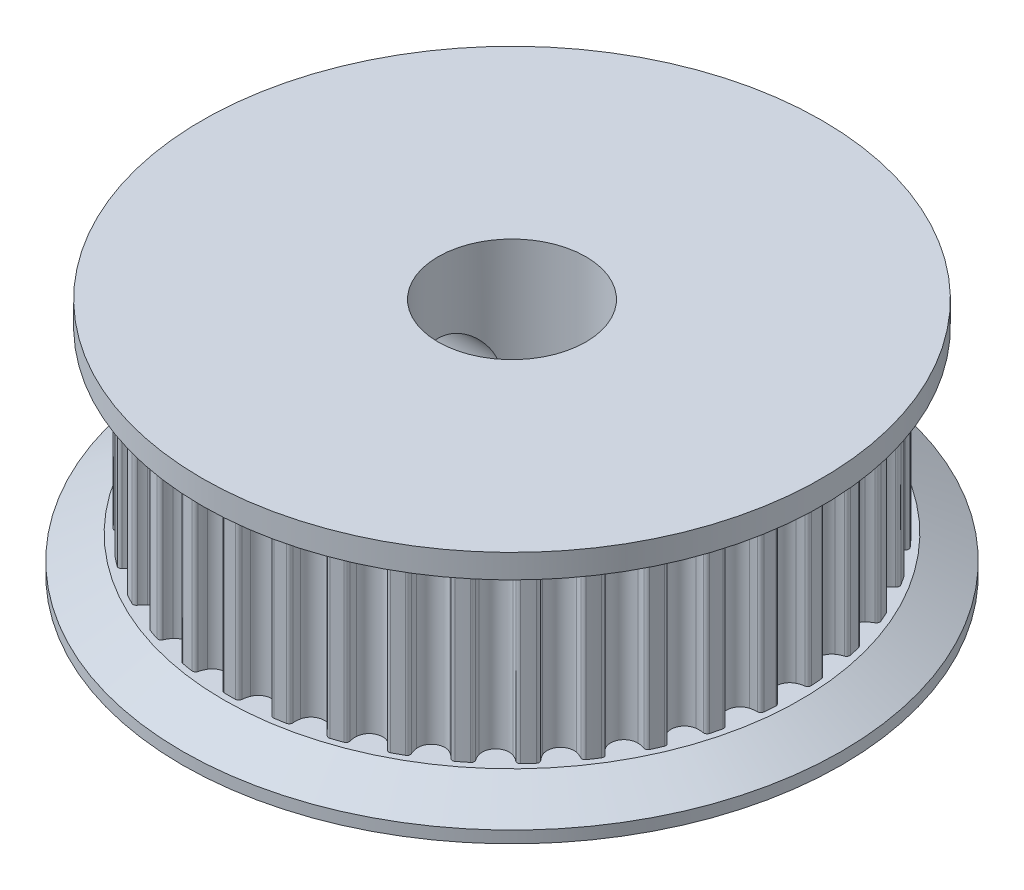
from build123d import *
from build123d.topology import SkipClean

# Parameters (mm, degrees)
SKETCH2_R           = 12.095775675
SKETCH2_R_2         = 3.1
BOSS_EXTRUDE1_DEPTH = 5
CUT_EXTRUDE3_DEPTH  = 18.821772593
CIRPATTERN3_COUNT   = 38
SKETCH4_W           = 6.5
SKETCH4_H           = 6
SKETCH5_R           = 1.6
CUT_EXTRUDE2_DEPTH  = 24.209213051
CIRPATTERN2_COUNT   = 2
CIRPATTERN2_ANGLE   = 90
SKETCH7_R           = 18
CUT_EXTRUDE4_DEPTH  = 10
SKETCH8_R           = 1.95
CUT_EXTRUDE5_DEPTH  = 21.60746395
CUT_EXTRUDE6_START  = -8
SKETCH10_R          = 2.75
CUT_EXTRUDE6_DEPTH  = 10
SKETCH11_R          = 13
BOSS_EXTRUDE3_DEPTH = 1
SKETCH12_R          = 3.1
CUT_EXTRUDE7_DEPTH  = 10


with BuildPart() as part:
    # Sketch2 → Boss-Extrude1 (new, symmetric)
    with BuildSketch(Plane(origin=(0, 0, 0), x_dir=(1, 0, 0), z_dir=(0, 1, 0))):
        Circle(SKETCH2_R)
        Circle(SKETCH2_R_2, mode=Mode.SUBTRACT)
    extrude(amount=BOSS_EXTRUDE1_DEPTH, both=True)

    # Sketch6 → Cut-Extrude3 (cut, symmetric)
    with BuildSketch(Plane(origin=(0, 0, 0), x_dir=(1, 0, 0), z_dir=(0, 1, 0))):
        with BuildLine():
            Line((0, 11.831775675), (0, 12.471775675))
            ThreePointArc((0, 12.471775675), (1.029911072, 12.429178238), (2.052786807, 12.301676911))
            Line((2.052786807, 12.301676911), (1.94744627, 11.670405676))
            ThreePointArc((1.94744627, 11.670405676), (1.832972216, 11.688931879), (1.718322087, 11.706335243))
            ThreePointArc((1.718322087, 11.706335243), (1.619459884, 11.683720455), (1.561806597, 11.600286275))
            ThreePointArc((1.561806597, 11.600286275), (1.515275101, 11.454869949), (1.447355853, 11.318129084))
            ThreePointArc((1.447355853, 11.318129084), (0.915125782, 11.043925793), (0.435287013, 11.401991499))
            ThreePointArc((0.435287013, 11.401991499), (0.390800902, 11.548046537), (0.368838776, 11.699138407))
            ThreePointArc((0.368838776, 11.699138407), (0.325704619, 11.790924073), (0.23191304, 11.829502609))
            ThreePointArc((0.23191304, 11.829502609), (0.115962089, 11.831207395), (0, 11.831775675))
        make_face()
    cut_extrude3 = extrude(amount=CUT_EXTRUDE3_DEPTH, both=True, mode=Mode.SUBTRACT)

    # CirPattern3: Cut-Extrude3 ×38 about axis
    cirpattern3_axis = Axis((0, 5, 0), (0, -1, 0))
    for i in range(1, CIRPATTERN3_COUNT):
        add(cut_extrude3.rotate(cirpattern3_axis, i * 360 / CIRPATTERN3_COUNT), mode=Mode.SUBTRACT)

    # Sketch3 → Revolve1 (revolve)
    with BuildSketch(Plane.XY):
        Polygon((-12.095775675, 5), (-13.827826483, 6), (-13.827826483, 6.5), (-3.1, 6.5), (-3.1, 5), align=None)
    revolve1 = revolve(axis=Axis((0, 0, 0), (0, 1, 0)))

    # Mirror1: Revolve1 across plane
    add(revolve1.mirror(Plane.ZX))

    # Sketch4 → Revolve2 (revolve)
    with BuildSketch(Plane.XY):
        with Locations((-6.35, 9.5)):
            Rectangle(SKETCH4_W, SKETCH4_H)
    revolve(axis=Axis((0, 0, 0), (0, 1, 0)))

    # Sketch5 → Cut-Extrude2 (cut, through all)
    with BuildSketch(Plane.XY):
        with Locations((0, 9.5)):
            Circle(SKETCH5_R)
    cut_extrude2 = extrude(amount=CUT_EXTRUDE2_DEPTH, mode=Mode.SUBTRACT)

    # CirPattern2: Cut-Extrude2 ×2 about axis
    cirpattern2_axis = Axis((0, 5, 0), (0, 1, 0))
    for i in range(1, CIRPATTERN2_COUNT):
        add(cut_extrude2.rotate(cirpattern2_axis, i * CIRPATTERN2_ANGLE / (CIRPATTERN2_COUNT - 1)), mode=Mode.SUBTRACT)

    # Sketch7 → Cut-Extrude4 (cut)
    with BuildSketch(Plane(origin=(0, 12.5, 0), x_dir=(1, 0, 0), z_dir=(0, 1, 0))):
        Circle(SKETCH7_R)
    extrude(amount=-CUT_EXTRUDE4_DEPTH, mode=Mode.SUBTRACT)

    # Sketch8 → Cut-Extrude5 (cut, through all)
    with SkipClean():  # the faces are left unmerged after this step: merging them gives an invalid solid
        with BuildSketch(Plane(origin=(0, 0, 0), x_dir=(0, 0, -1), z_dir=(1, 0, 0))):
            with Locations((0, -1.414575603)):
                Circle(SKETCH8_R)
        extrude(amount=-CUT_EXTRUDE5_DEPTH, mode=Mode.SUBTRACT)

    # Sketch10 → Cut-Extrude6 (cut)
    with SkipClean():  # the faces are left unmerged after this step: merging them gives an invalid solid
        with BuildSketch(Plane(origin=(0, 0, 0), x_dir=(0, 0, -1), z_dir=(1, 0, 0)).offset(CUT_EXTRUDE6_START)):
            with Locations((0, -1.414575603)):
                Circle(SKETCH10_R)
        extrude(amount=-CUT_EXTRUDE6_DEPTH, mode=Mode.SUBTRACT)

    # Sketch11 → Boss-Extrude3 (add)
    with SkipClean():  # the faces are left unmerged after this step: merging them gives an invalid solid
        with BuildSketch(Plane(origin=(0, 2.5, 0), x_dir=(1, 0, 0), z_dir=(0, 1, 0))):
            Circle(SKETCH11_R)
        extrude(amount=BOSS_EXTRUDE3_DEPTH)

    # Sketch12 → Cut-Extrude7 (cut)
    with BuildSketch(Plane(origin=(0, 3.5, 0), x_dir=(1, 0, 0), z_dir=(0, 1, 0))):
        Circle(SKETCH12_R)
    extrude(amount=-CUT_EXTRUDE7_DEPTH, mode=Mode.SUBTRACT)


solid = part.part
